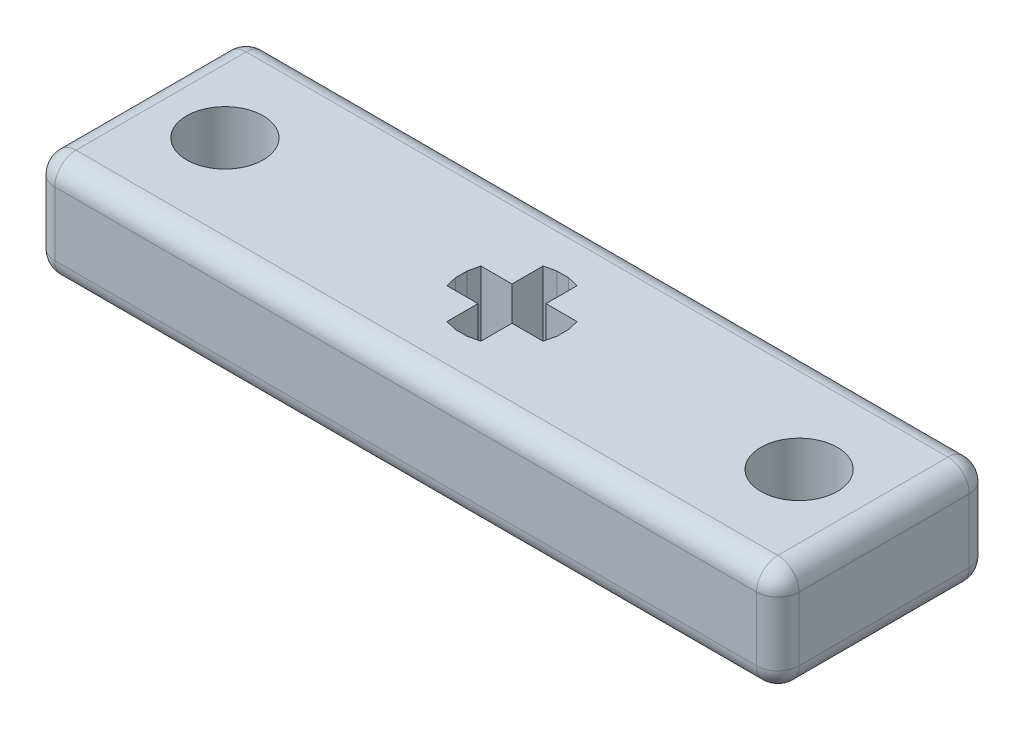
from build123d import *

# Parameters (mm, degrees)
SKETCH1_W            = 35
SKETCH1_H            = 10
BOSS_EXTRUDE1_DEPTH  = 5
FILLET4_R            = 1
M3_CLEARANCE_HOLE1_D = 3.6
FILLET6_R            = 1


with BuildPart() as part:
    # Sketch1 → Boss-Extrude1 (new body)
    with BuildSketch(Plane(origin=(0, 0, 0), x_dir=(1, 0, 0), z_dir=(0, 1, 0))):
        Rectangle(SKETCH1_W, SKETCH1_H)
        Polygon((-0.8, 0.8), (-0.8, 2.2627417), (-0.270125178, 2.384749963), (0.270125178, 2.384749963), (0.8, 2.2627417), (0.8, 0.8), (2.2627417, 0.8), (2.384749963, 0.270125178), (2.384749963, -0.270125178), (2.2627417, -0.8), (0.8, -0.8), (0.8, -2.2627417), (0.270125178, -2.384749963), (-0.270125178, -2.384749963), (-0.8, -2.2627417), (-0.8, -0.8), (-2.2627417, -0.8), (-2.384749963, -0.270125178), (-2.384749963, 0.270125178), (-2.2627417, 0.8), align=None, mode=Mode.SUBTRACT)
    extrude(amount=BOSS_EXTRUDE1_DEPTH)

    # Fillet4
    fillet4_edges = [part.edges().sort_by_distance(p)[0] for p in [
        (17.5, 2.5, -5),
        (17.5, 2.5, 5),
        (-17.5, 2.5, 5),
        (-17.5, 2.5, -5),
    ]]
    fillet(fillet4_edges, radius=FILLET4_R)

    # M3 Clearance Hole1 (through all)
    with Locations(Plane(origin=(-13.5, 5, 0), x_dir=(0, 0, 1), z_dir=(0, 1, 0))):
        with Locations((0, 0), (0, 27)):
            Hole(M3_CLEARANCE_HOLE1_D / 2)

    # Fillet6
    fillet6_edges = [part.edges().sort_by_distance(p)[0] for p in [
        (-17.207106781, 5, 4.707106781),
        (0, 5, 5),
        (17.207106781, 5, 4.707106781),
        (17.207106781, 5, -4.707106781),
        (0, 5, -5),
        (-17.207106781, 5, -4.707106781),
        (-17.207106781, 0, 4.707106781),
        (0, 0, 5),
        (17.207106781, 0, 4.707106781),
        (17.207106781, 0, -4.707106781),
        (0, 0, -5),
        (-17.207106781, 0, -4.707106781),
        (17.5, 5, 0),
        (17.5, 0, 0),
        (-17.5, 5, 0),
        (-17.5, 0, 0),
    ]]
    fillet(fillet6_edges, radius=FILLET6_R)


solid = part.part
